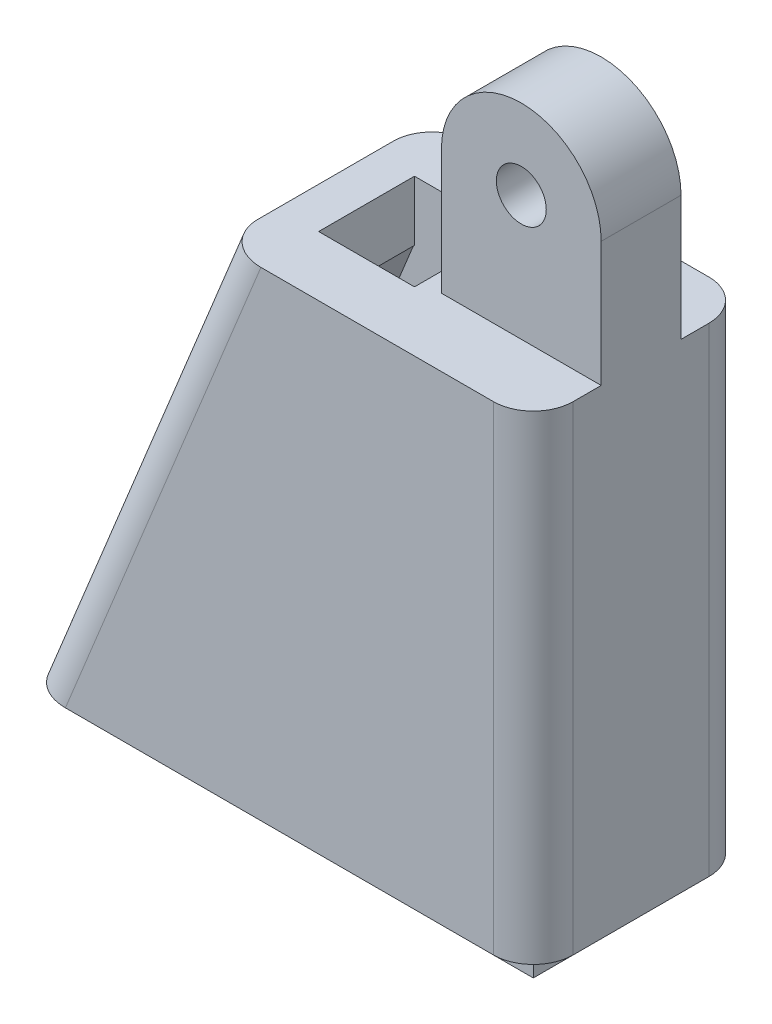
from build123d import *

# Parameters (mm, degrees)
SKETCH1_W           = 26
SKETCH1_H           = 10.8
BOSS_EXTRUDE1_DEPTH = 25
SKETCH2_W           = 8
SKETCH2_H           = 4
BOSS_EXTRUDE2_DEPTH = 10.25
SKETCH3_R           = 1.25
CUT_EXTRUDE1_DEPTH  = 10.25
CUT_EXTRUDE2_DEPTH  = 40.092230686
SHELL1_START        = -2.4
SHELL1_DEPTH        = 4.8
SKETCH5_W           = 4.8
SKETCH5_H           = 4.8
CUT_EXTRUDE3_DEPTH  = 10.25
SKETCH6_W           = 1
SKETCH6_H           = 1
CUT_EXTRUDE4_DEPTH  = 45.133009188
SKETCH7_W           = 1
SKETCH7_H           = 1
CUT_EXTRUDE5_DEPTH  = 10.25
FILLET1_R           = 2
FILLET2_R           = 2


# Read off the part's stored shape, not the designer's step: Shell1
with BuildPart() as part:
    # Sketch1 → Boss-Extrude1 (new body)
    with BuildSketch(Plane(origin=(0, 0, 0), x_dir=(1, 0, 0), z_dir=(0, 1, 0))):
        Rectangle(SKETCH1_W, SKETCH1_H)
    extrude(amount=BOSS_EXTRUDE1_DEPTH)

    # Sketch2 → Boss-Extrude2 (add)
    with BuildSketch(Plane(origin=(0, 25, 0), x_dir=(1, 0, 0), z_dir=(0, 1, 0))):
        with Locations((9, 0)):
            Rectangle(SKETCH2_W, SKETCH2_H)
    extrude(amount=BOSS_EXTRUDE2_DEPTH)

    # Sketch3 → Cut-Extrude1 (cut)
    with BuildSketch(Plane.XY.offset(2)):
        with Locations((9, 31.25)):
            Circle(SKETCH3_R)
        with BuildLine():
            Line((5, 31.25), (5, 37.25))
            Line((5, 37.25), (13, 37.25))
            Line((13, 37.25), (13, 31.25))
            ThreePointArc((13, 31.25), (9, 35.25), (5, 31.25))
        make_face()
    extrude(amount=-CUT_EXTRUDE1_DEPTH, mode=Mode.SUBTRACT)

    # Sketch4 → Cut-Extrude2 (cut, through all)
    with BuildSketch(Plane.XY.offset(5.4)):
        Polygon((-13, 0), (-2.8, 25), (-13, 25), align=None)
    extrude(amount=-CUT_EXTRUDE2_DEPTH, mode=Mode.SUBTRACT)

    # Shell1 outline → Shell1 (cut)
    with BuildSketch(Plane.XY.offset(SHELL1_START)):
        Polygon((10, 0), (10, 22), (-0.783911112, 22), (-9.759911112, 0), align=None)
    extrude(amount=SHELL1_DEPTH, mode=Mode.SUBTRACT)

    # Sketch5 → Cut-Extrude3 (cut)
    with BuildSketch(Plane(origin=(0, 25, 0), x_dir=(1, 0, 0), z_dir=(0, 1, 0))):
        with Locations((1.65, 0)):
            Rectangle(SKETCH5_W, SKETCH5_H)
    extrude(amount=-CUT_EXTRUDE3_DEPTH, mode=Mode.SUBTRACT)

    # Sketch6 → Cut-Extrude4 (cut, through all)
    with BuildSketch(Plane(origin=(13, 0, 0), x_dir=(0, 0, -1), z_dir=(1, 0, 0))):
        with Locations((-4.9, 0.5)):
            Rectangle(SKETCH6_W, SKETCH6_H)
        with Locations((4.9, 0.5)):
            Rectangle(SKETCH6_W, SKETCH6_H)
    extrude(amount=-CUT_EXTRUDE4_DEPTH, mode=Mode.SUBTRACT)

    # Sketch7 → Cut-Extrude5 (cut)
    with BuildSketch(Plane(origin=(0, 0, -5.4), x_dir=(-1, 0, 0), z_dir=(0, 0, -1))):
        with Locations((-12.5, 0.5)):
            Rectangle(SKETCH7_W, SKETCH7_H)
        with Locations((12.5, 0.5)):
            Rectangle(SKETCH7_W, SKETCH7_H)
    extrude(amount=-CUT_EXTRUDE5_DEPTH, mode=Mode.SUBTRACT)

    # Fillet1
    fillet1_edges = [part.edges().sort_by_distance(p)[0] for p in [
        (13, 13, 5.4),
        (-7.696, 13, 5.4),
        (-7.696, 13, -5.4),
        (13, 13, -5.4),
    ]]
    fillet(fillet1_edges, radius=FILLET1_R)

    # Fillet2
    fillet2_edges = [part.edges().sort_by_distance(p)[0] for p in [
        (12, 0.5, -4.4),
        (-12, 0.5, -4.4),
        (-12, 0.5, 4.4),
    ]]
    fillet(fillet2_edges, radius=FILLET2_R)


solid = part.part
